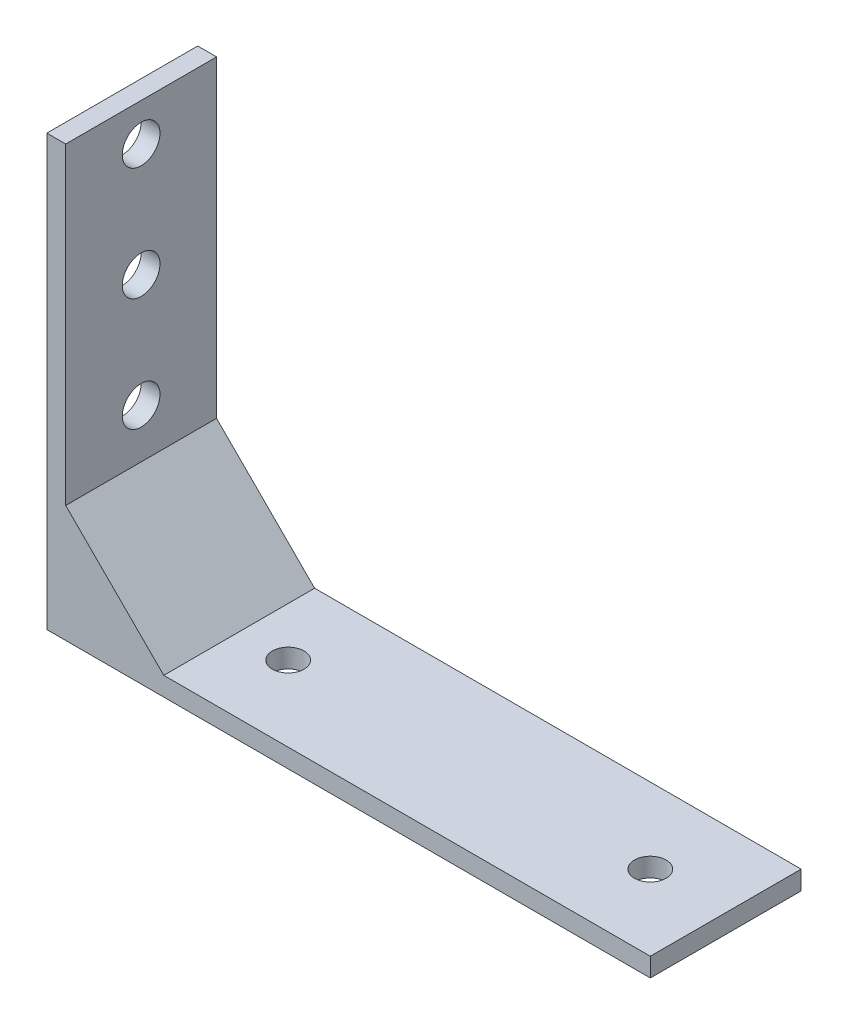
from build123d import *

# Parameters (mm, degrees)
BOSS_EXTRUDE1_DEPTH = 25.4
SKETCH2_R           = 2.667
CUT_EXTRUDE1_DEPTH  = 25.4
SKETCH3_R           = 3.175
CUT_EXTRUDE2_DEPTH  = 128.310769772
BOSS_EXTRUDE2_DEPTH = 25.4


with BuildPart() as part:
    # Sketch1 → Boss-Extrude1 (new body)
    with BuildSketch(Plane.XY):
        Polygon((0, 3.175), (0, 0), (3.175, 0), (101.6, 0), (101.6, 3.175), (3.175, 3.175), (3.175, 72.39), (0, 72.39), align=None)
    extrude(amount=BOSS_EXTRUDE1_DEPTH)

    # Sketch2 → Cut-Extrude1 (cut)
    with BuildSketch(Plane(origin=(0, 3.175, 0), x_dir=(1, 0, 0), z_dir=(0, 1, 0))):
        with Locations((88.9, -12.7)):
            Circle(SKETCH2_R)
        with Locations((27.94, -12.7)):
            Circle(SKETCH2_R)
    extrude(amount=-CUT_EXTRUDE1_DEPTH, mode=Mode.SUBTRACT)

    # Sketch3 → Cut-Extrude2 (cut, through all)
    with BuildSketch(Plane.ZY):
        with Locations((12.7, 27.94)):
            Circle(SKETCH3_R)
        with Locations((12.7, 46.99)):
            Circle(SKETCH3_R)
        with Locations((12.7, 66.04)):
            Circle(SKETCH3_R)
    extrude(amount=-CUT_EXTRUDE2_DEPTH, mode=Mode.SUBTRACT)

    # Sketch4 → Boss-Extrude2 (add)
    with BuildSketch(Plane.XY.offset(25.4)):
        Polygon((3.175, 19.685), (19.685, 3.175), (3.175, 3.175), align=None)
    extrude(amount=-BOSS_EXTRUDE2_DEPTH)


solid = part.part
